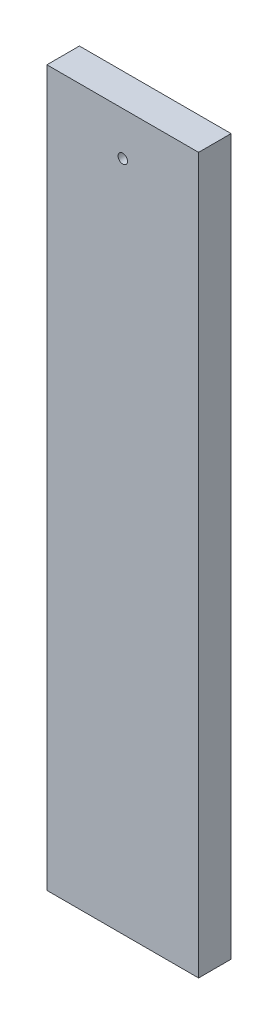
from build123d import *

# Parameters (mm, degrees)
SKETCH1_W           = 88.9
SKETCH1_H           = 19.05
BOSS_EXTRUDE1_DEPTH = 419.1
SKETCH2_R           = 2.778125
CUT_EXTRUDE1_DEPTH  = 429.848367725


with BuildPart() as part:
    # Sketch1 → Boss-Extrude1 (new body)
    with BuildSketch(Plane(origin=(0, 0, 0), x_dir=(1, 0, 0), z_dir=(0, 1, 0))):
        with Locations((44.45, 9.525)):
            Rectangle(SKETCH1_W, SKETCH1_H)
    extrude(amount=BOSS_EXTRUDE1_DEPTH)

    # Sketch2 → Cut-Extrude1 (cut, through all)
    with BuildSketch(Plane.XY):
        with Locations((44.45, 393.7)):
            Circle(SKETCH2_R)
    extrude(amount=-CUT_EXTRUDE1_DEPTH, mode=Mode.SUBTRACT)


solid = part.part
